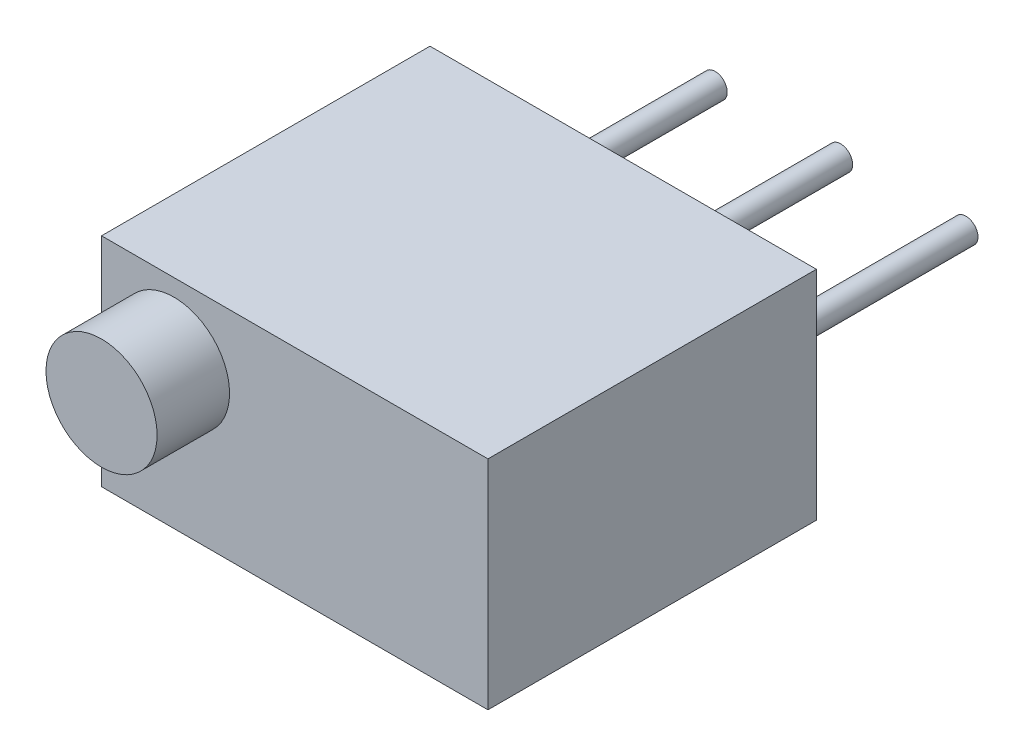
from build123d import *

# Parameters (mm, degrees)
SKETCH_1_W      = 8
SKETCH_1_H      = 6.8
EXTRUDE_1_DEPTH = 4.5
SKETCH_3_R      = 0.25
EXTRUDE_3_DEPTH = 4.5
SKETCH_4_R      = 1.15
EXTRUDE_4_DEPTH = 1.5


with BuildPart() as part:
    # 草图1 → 拉伸1 (new body)
    with BuildSketch(Plane(origin=(0, 0, 0), x_dir=(1, 0, 0), z_dir=(0, 1, 0))):
        Rectangle(SKETCH_1_W, SKETCH_1_H)
    extrude(amount=EXTRUDE_1_DEPTH)

    # 草图3 → 拉伸3 (add)
    with BuildSketch(Plane(origin=(0, 0, -3.4), x_dir=(-1, 0, 0), z_dir=(0, 0, -1))):
        with Locations((0, 2.25)):
            Circle(SKETCH_3_R)
        with Locations((2.595978382, 2.25)):
            Circle(SKETCH_3_R)
        with Locations((-2.595978382, 2.25)):
            Circle(SKETCH_3_R)
    extrude(amount=EXTRUDE_3_DEPTH)

    # 草图4 → 拉伸4 (add)
    with BuildSketch(Plane.XY.offset(3.4)):
        with Locations((-2.5, 3)):
            Circle(SKETCH_4_R)
    extrude(amount=EXTRUDE_4_DEPTH)


solid = part.part
